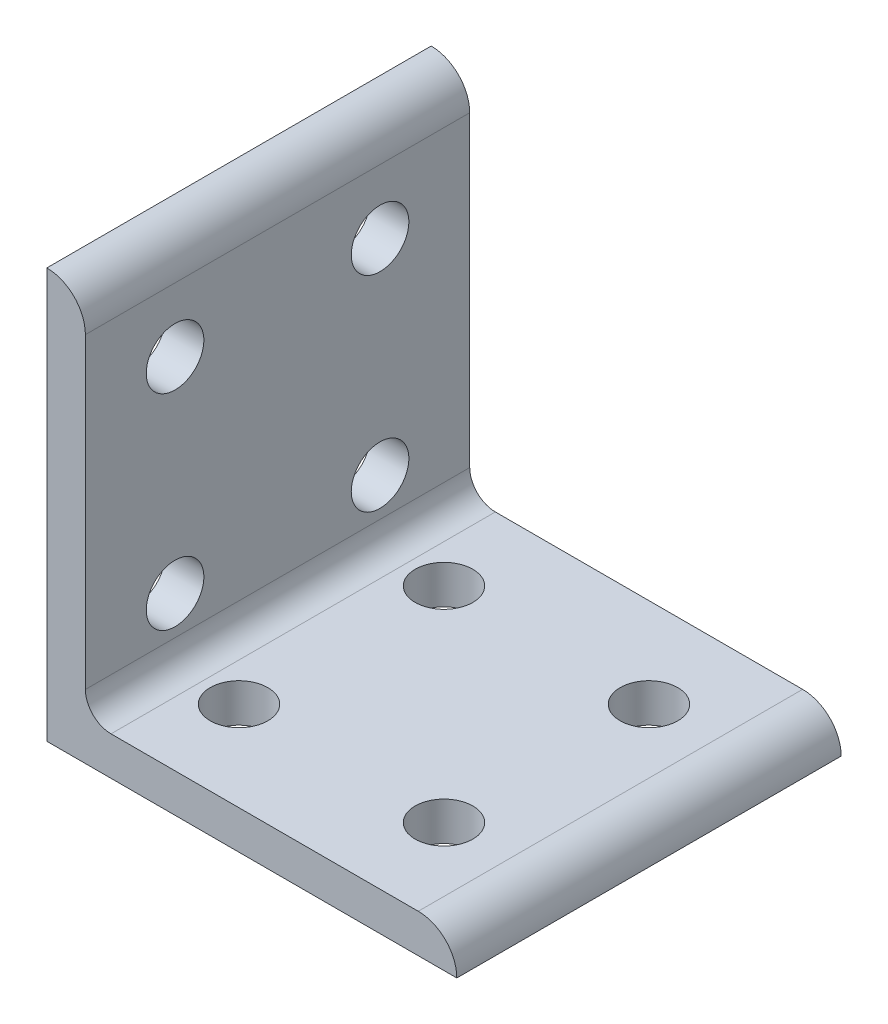
from build123d import *

# Parameters (mm, degrees)
BOSS_EXTRUDE1_DEPTH = 23.8125
SKETCH2_R           = 3.5687
CUT_EXTRUDE1_DEPTH  = 76.685633751
SKETCH3_R           = 3.5687
CUT_EXTRUDE2_DEPTH  = 76.685633751


with BuildPart() as part:
    # Sketch1 → Boss-Extrude1 (new, symmetric)
    with BuildSketch(Plane.XY):
        with BuildLine():
            Line((0, 0), (0, 50.8))
            ThreePointArc((0, 50.8), (3.376576302, 49.401376302), (4.7752, 46.0248))
            Line((4.7752, 46.0248), (4.7752, 7.9502))
            ThreePointArc((4.7752, 7.9502), (5.70513597, 5.70513597), (7.9502, 4.7752))
            Line((7.9502, 4.7752), (46.0248, 4.7752))
            ThreePointArc((46.0248, 4.7752), (49.401376302, 3.376576302), (50.8, 0))
            Line((50.8, 0), (0, 0))
        make_face()
    extrude(amount=BOSS_EXTRUDE1_DEPTH, both=True)

    # Sketch2 → Cut-Extrude1 (cut, through all)
    with BuildSketch(Plane(origin=(0, 0, 0), x_dir=(1, 0, 0), z_dir=(0, 1, 0))):
        with Locations((12.7, -12.7)):
            Circle(SKETCH2_R)
        with Locations((38.1, -12.7)):
            Circle(SKETCH2_R)
        with Locations((12.7, 12.7)):
            Circle(SKETCH2_R)
        with Locations((38.1, 12.7)):
            Circle(SKETCH2_R)
    extrude(amount=CUT_EXTRUDE1_DEPTH, mode=Mode.SUBTRACT)

    # Sketch3 → Cut-Extrude2 (cut, through all)
    with BuildSketch(Plane(origin=(0, 0, 0), x_dir=(0, 0, -1), z_dir=(1, 0, 0))):
        with Locations((-12.7, 12.7)):
            Circle(SKETCH3_R)
        with Locations((-12.7, 38.1)):
            Circle(SKETCH3_R)
        with Locations((12.7, 12.7)):
            Circle(SKETCH3_R)
        with Locations((12.7, 38.1)):
            Circle(SKETCH3_R)
    extrude(amount=CUT_EXTRUDE2_DEPTH, mode=Mode.SUBTRACT)


solid = part.part
